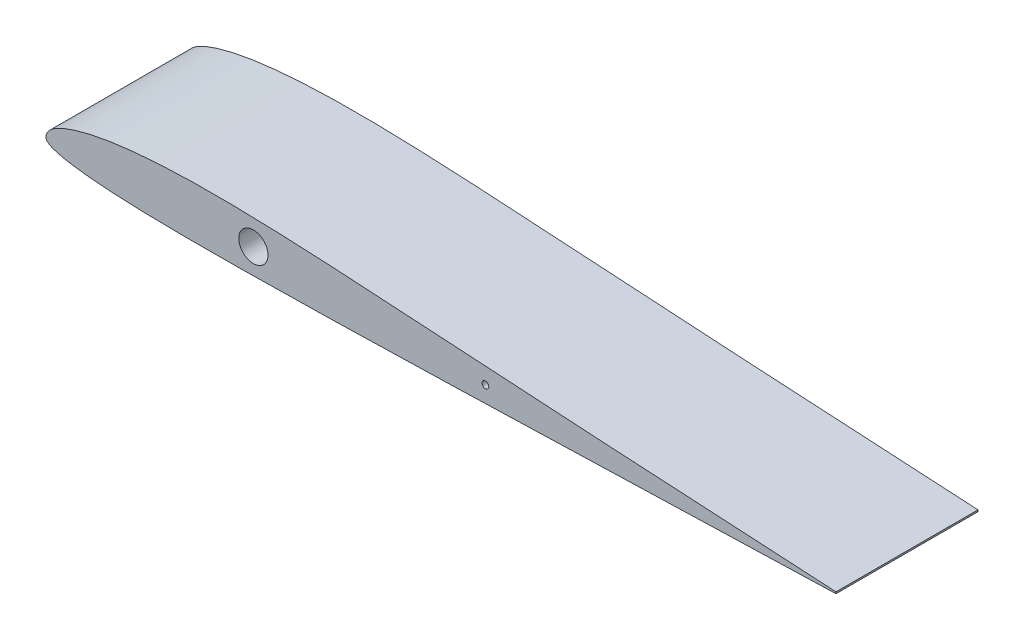
from build123d import *

# Parameters (mm, degrees)
AIRFOIL_DEPTH        = 36.5252
CAMERA_CHANNEL_REACH = 208.647
SKETCH8_R            = 3.7592
SKETCH9_R            = 0.8636
CUT_EXTRUDE1_DEPTH   = 207.646588533


with BuildPart() as part:
    # Sketch3 → Airfoil (new body)
    with BuildSketch(Plane.XY):
        with BuildLine():
            Line((203.2026416, 0.2115312), (203.1973584, -0.2115312))
            add(Edge.make_bspline(
                [(203.2026416, 0.2115312), (202.749975414, 0.235767735), (201.482227455, 0.303645165), (199.229899451, 0.427581862), (196.304631843, 0.58645357), (192.978703522, 0.769351745), (189.375038631, 0.970599063), (185.612938037, 1.178498421), (181.773697727, 1.395742795), (177.899622281, 1.614727685), (174.009999544, 1.835420869), (170.113241345, 2.055248875), (166.213278896, 2.277505712), (162.311711246, 2.498550948), (158.410741475, 2.722039599), (154.51059314, 2.944050358), (150.614228349, 3.167765812), (146.720449867, 3.393606246), (142.830938385, 3.617021658), (138.944036437, 3.845362214), (135.059465523, 4.072120956), (131.177542014, 4.301224247), (127.296716125, 4.531457234), (123.418858544, 4.764935655), (119.542057199, 5.000803845), (115.667451592, 5.239845443), (111.794903734, 5.481590715), (107.92356364, 5.724700666), (104.057153857, 5.968055719), (100.189436188, 6.212019472), (96.318759225, 6.454299415), (92.447746967, 6.694605077), (88.584023823, 6.932155402), (84.741460885, 7.163725688), (80.922901098, 7.388921542), (77.397782248, 7.59058238), (74.522903974, 7.749287039), (71.994617804, 7.884276403), (69.124106699, 8.032386004), (65.508268577, 8.20759336), (61.485211762, 8.383132514), (57.521769068, 8.532806767), (53.67337931, 8.65196061), (49.905829014, 8.739019457), (46.180960609, 8.791245505), (42.490964532, 8.80473096), (38.846800487, 8.774220372), (35.259629974, 8.696203332), (31.756076473, 8.567101257), (28.366063073, 8.385637047), (25.12916512, 8.151985933), (22.079780002, 7.868751339), (19.258728777, 7.54280933), (16.701884478, 7.183689544), (14.433629815, 6.805801873), (12.454092042, 6.421559693), (10.747122797, 6.041820295), (9.282979556, 5.674052725), (8.026380981, 5.32164067), (6.939364861, 4.984377042), (5.987597489, 4.659887308), (5.142872565, 4.34265889), (4.375389754, 4.030109088), (3.657744375, 3.708063164), (2.964607554, 3.360683786), (2.286752141, 2.970800639), (1.638361257, 2.53049627), (1.049962466, 2.035518438), (0.55105342, 1.482304271), (0.182124171, 0.879494893), (0.020226764, 0.365089231), (-0.006478658, -0.019297801), (0.019393578, -0.313623078), (0.126773921, -0.614429835), (0.296985654, -0.854594391), (0.474203046, -1.0360418), (0.692231827, -1.205448428), (0.984641636, -1.3848123), (1.352473451, -1.566840486), (1.779379473, -1.744801104), (2.260500407, -1.917169047), (2.806664849, -2.087583046), (3.441332814, -2.260164552), (4.188115361, -2.438004982), (5.06690206, -2.621532136), (6.092157789, -2.806861911), (7.276571085, -2.993059902), (8.634334508, -3.178000051), (10.186878433, -3.35940408), (11.960820402, -3.536894099), (13.988248891, -3.707664418), (16.294928682, -3.868904436), (18.89372996, -4.015528606), (21.766154486, -4.143679461), (24.87293007, -4.249244795), (28.158435839, -4.329742718), (31.577459925, -4.386681674), (35.091351007, -4.420650673), (38.679106505, -4.435118029), (42.321638443, -4.431127332), (46.012586406, -4.412453932), (49.757901166, -4.379533307), (53.580508995, -4.337179517), (57.514943683, -4.284200631), (61.595949927, -4.220224301), (65.884086903, -4.144461591), (69.583989281, -4.072095586), (72.808820505, -4.005043155), (75.579862857, -3.944754288), (78.770794894, -3.87272284), (82.213745044, -3.790898591), (85.812278509, -3.702057045), (89.454775682, -3.609141494), (93.150227317, -3.511616573), (96.888909494, -3.411069637), (100.657029944, -3.306886052), (104.439744756, -3.201756582), (108.224810971, -3.094514402), (112.008194618, -2.986301144), (115.791031649, -2.876635979), (119.578217649, -2.765818396), (123.376483987, -2.65229883), (127.194486092, -2.537598816), (131.04164704, -2.420012089), (134.919802339, -2.301989441), (138.81936176, -2.182338271), (142.726333168, -2.060156236), (146.633431624, -1.937306429), (150.540542811, -1.8169006), (154.447614149, -1.693516374), (158.354722861, -1.573509134), (162.26148206, -1.451514239), (166.167503923, -1.331681527), (170.071797885, -1.208888837), (173.972889131, -1.08970993), (177.866894682, -0.967751167), (181.74532249, -0.848820183), (185.588910116, -0.731171396), (189.354936457, -0.616949477), (192.962622684, -0.509627047), (196.29203641, -0.412964276), (199.220341745, -0.324818889), (201.475188064, -0.261715668), (202.74429193, -0.224733669), (203.1973584, -0.2115312)],
                knots=[0, 0, 0, 0, 0.003315783, 0.009286262, 0.01649964, 0.024744274, 0.033650618, 0.042899826, 0.052304254, 0.061777775, 0.071282103, 0.080800776, 0.090326048, 0.099854782, 0.109384674, 0.118906596, 0.128428716, 0.137931689, 0.147435622, 0.156925556, 0.166411563, 0.175897802, 0.185369409, 0.194847889, 0.20431387, 0.213778822, 0.22324269, 0.232694875, 0.242151635, 0.251579623, 0.261041636, 0.270519226, 0.279948764, 0.289356316, 0.298676754, 0.307928254, 0.315183044, 0.31973714, 0.326447814, 0.336207398, 0.346216249, 0.35590244, 0.365218591, 0.374378655, 0.38346733, 0.392466507, 0.40136886, 0.410122896, 0.418710299, 0.427012022, 0.434953476, 0.442446764, 0.449411134, 0.455723479, 0.461330459, 0.466229103, 0.470471324, 0.474119786, 0.477269946, 0.48001617, 0.482443707, 0.48462406, 0.486615379, 0.48850422, 0.490376245, 0.492284157, 0.494220159, 0.496101738, 0.49789553, 0.499645689, 0.501236957, 0.501776184, 0.502456996, 0.50338555, 0.504071488, 0.504595279, 0.505236101, 0.506085552, 0.507100329, 0.508234964, 0.509466926, 0.51083723, 0.512418824, 0.514276846, 0.516451552, 0.518984588, 0.521896832, 0.525220723, 0.529007031, 0.533329617, 0.538260507, 0.543888673, 0.550242528, 0.557299236, 0.564919576, 0.572979857, 0.581338081, 0.589931372, 0.59868335, 0.607580916, 0.616574706, 0.62568118, 0.63497715, 0.644536982, 0.654462302, 0.664831439, 0.675907565, 0.68153051, 0.688424661, 0.696181232, 0.704876621, 0.713615329, 0.722510831, 0.73152844, 0.74065523, 0.749867421, 0.759101002, 0.768334695, 0.777564511, 0.786785993, 0.796015995, 0.805277853, 0.814580932, 0.823955486, 0.833431168, 0.842960949, 0.852492353, 0.862022798, 0.871553661, 0.881084601, 0.890615434, 0.900145802, 0.909674638, 0.919199589, 0.928717996, 0.938222598, 0.947696375, 0.957100207, 0.966349803, 0.975255754, 0.983500408, 0.990713161, 0.996684625, 1, 1, 1, 1], degree=3))
        make_face()
    extrude(amount=AIRFOIL_DEPTH)

    # Sketch8 → Camera Channel (cut, up to next)
    with BuildSketch(Plane(origin=(0, 0, 0), x_dir=(-1, 0, 0), z_dir=(0, 0, -1)), mode=Mode.PRIVATE) as camera_channel_sk1:
        with Locations((-53.339999981, 2.15866289)):
            Circle(SKETCH8_R)
    camera_channel_tool1 = extrude(camera_channel_sk1.sketch, amount=-CAMERA_CHANNEL_REACH, mode=Mode.PRIVATE) & part.part
    add(camera_channel_tool1.solids().sort_by_distance((53.34, 2.158663, 0))[0], mode=Mode.SUBTRACT)

    # Sketch9 → Cut-Extrude1 (cut, through all)
    with BuildSketch(Plane(origin=(0, 0, 0), x_dir=(-1, 0, 0), z_dir=(0, 0, -1))):
        with Locations((-113.029999981, 1.22400007)):
            Circle(SKETCH9_R)
    extrude(amount=-CUT_EXTRUDE1_DEPTH, mode=Mode.SUBTRACT)


solid = part.part
